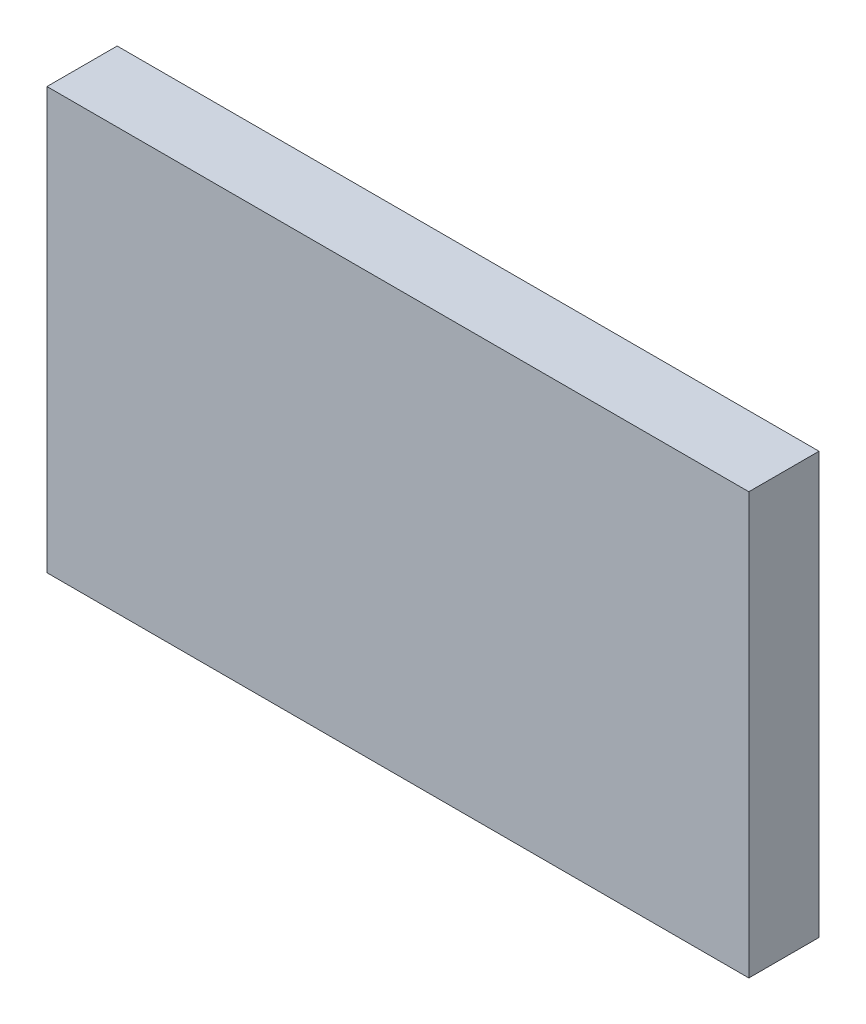
from build123d import *

# Parameters (mm, degrees)
ESQUISSE1_W        = 200
ESQUISSE1_H        = 120
BOSS_EXTRU_1_DEPTH = 20


with BuildPart() as part:
    # Esquisse1 → Boss.-Extru.1 (new body)
    with BuildSketch(Plane.XY):
        with Locations((109.46747226, 28.673805023)):
            Rectangle(ESQUISSE1_W, ESQUISSE1_H)
    extrude(amount=BOSS_EXTRU_1_DEPTH)


solid = part.part
